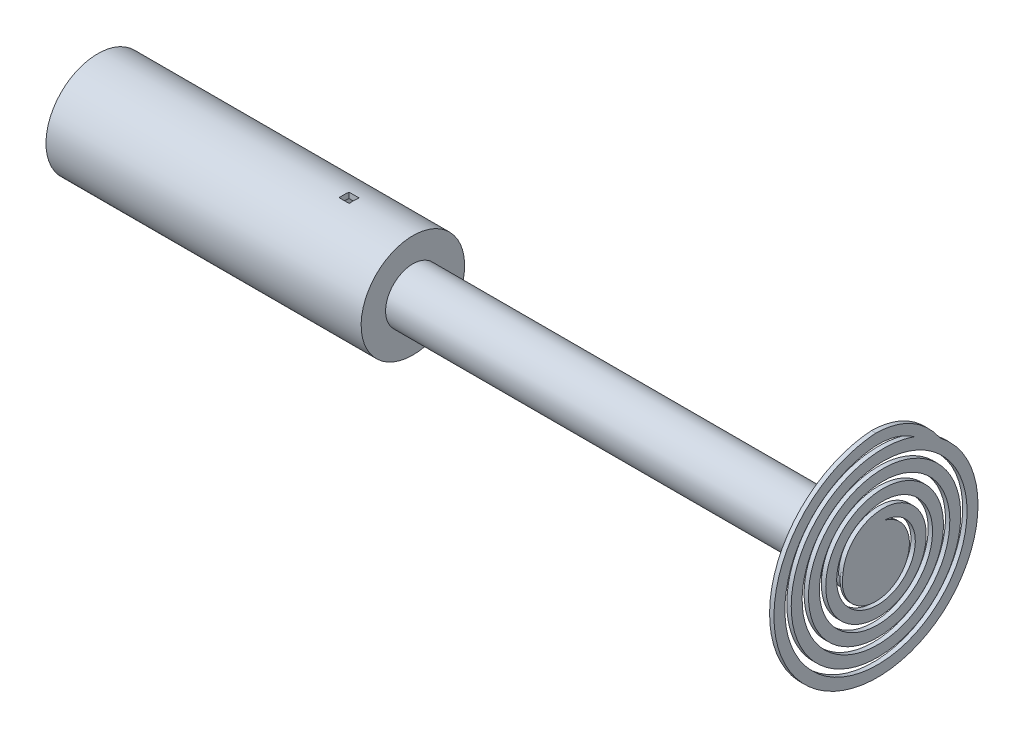
from build123d import *

# Parameters (mm, degrees)
BOSS_EXTRUDE1_DEPTH      = 10
BOSS_EXTRUDE1_DEPTH_BACK = 400
SKETCH1_R                = 24.95
CUT_EXTRUDE2_DEPTH       = 37
CUT_EXTRUDE2_DEPTH_BACK  = 119
SKETCH4_W                = 9.200985146
SKETCH4_H                = 9.100014535
BOSS_EXTRUDE3_DEPTH      = 11
BOSS_EXTRUDE3_DEPTH_BACK = 1
SKETCH5_R                = 24.95
SWEEP1_START             = 19
SWEEP1_DEPTH             = 4
SKETCH10_R               = 30.659130024
BOSS_EXTRUDE4_DEPTH      = 2
BOSS_EXTRUDE5_DEPTH      = 4


# Read off the part's stored shape, not the designer's step: Sweep1
with BuildPart() as part:
    # Sketch1 → Boss-Extrude1 (new, two sides: drawn at the far end of the back side and taken through both)
    with BuildSketch(Plane(origin=(0, 0, 0), x_dir=(0, 0, -1), z_dir=(1, 0, 0)).offset(-BOSS_EXTRUDE1_DEPTH_BACK)):
        Circle(SKETCH1_R)
    extrude(amount=BOSS_EXTRUDE1_DEPTH + BOSS_EXTRUDE1_DEPTH_BACK)

    # Sketch2 → Revolve1 (revolve)
    with BuildSketch(Plane.XY, mode=Mode.PRIVATE) as revolve1_sk:
        Polygon((-440, 42.271499293), (-440, 47.271499293), (-479.272562378, 47.271499293), (-479.272562378, 42.271499293), (-479.272562378, 0), (-473.972562378, 0), (-473.972562378, 42.271499293), (-445.301695371, 42.271499293), (-445.301695371, 0), (-440, 0), align=None)
        Polygon((-479.272562378, 42.271499293), (-479.272562378, 47.271499293), (-687.950461479, 47.271499293), (-687.950461479, 0), (-682.950461479, 0), (-682.950461479, 42.271499293), align=None)
        Polygon((-405, 0), (-400, 0), (-400, 47.271499293), (-440, 47.271499293), (-440, 42.271499293), (-405, 42.271499293), align=None)
    revolve(revolve1_sk.sketch.rotate(Axis((-687.950461479, 0, 0), (1, 0, 0)), 180), axis=Axis((-687.950461479, 0, 0), (1, 0, 0)))

    # Sketch4 → Cut-Extrude2 (cut, two sides: drawn at the far end of the back side and taken through both)
    with BuildSketch(Plane(origin=(0, 45, 0), x_dir=(1, 0, 0), z_dir=(0, 1, 0)).offset(-CUT_EXTRUDE2_DEPTH_BACK)):
        with Locations((-459.296485762, 1.019413137)):
            Rectangle(SKETCH4_W, SKETCH4_H)
    extrude(amount=CUT_EXTRUDE2_DEPTH + CUT_EXTRUDE2_DEPTH_BACK, mode=Mode.SUBTRACT)

    # Sketch5 → Boss-Extrude3 (add, two sides: drawn at the far end of the back side and taken through both)
    with BuildSketch(Plane(origin=(10, 0, 0), x_dir=(0, 0, -1), z_dir=(1, 0, 0)).offset(-BOSS_EXTRUDE3_DEPTH_BACK)):
        Circle(SKETCH5_R)
    extrude(amount=BOSS_EXTRUDE3_DEPTH + BOSS_EXTRUDE3_DEPTH_BACK)

    # Sweep1 outline → Sweep1 (add)
    with BuildSketch(Plane.YZ.offset(SWEEP1_START)):
        with BuildLine():
            Line((2.889682399, 30.019200586), (2.670037713, 20.021613066))
            add(Edge.make_bspline(
                [(2.670037713, 20.021613066), (4.643254667, 20.140878292), (6.662545734, 20.015193829), (11.641897523, 19.071902133), (14.584072415, 17.932365495), (19.941134402, 14.584553651), (22.353624344, 12.376947085), (26.263217032, 7.140524972), (27.763169757, 4.105304989), (29.571455998, -2.419265568), (29.87843846, -5.906377084), (29.179134374, -12.859641345), (28.170649186, -16.332279615), (24.893235583, -22.769976972), (22.624881883, -25.732354411), (17.077270799, -30.692631645), (13.79213913, -32.693730547), (6.604600395, -35.392201832), (2.70455096, -36.087936126), (-4.861302659, -36.005023473), (-8.525144089, -35.344513577), (-15.508988776, -32.792219927), (-18.825870637, -30.903474221), (-24.708805359, -26.053315077), (-27.271658075, -23.09462018), (-31.304195397, -16.400901436), (-32.772453314, -12.667140536), (-34.387607361, -4.828260302), (-34.533990287, -0.722128058), (-33.424667964, 7.398040179), (-32.168791427, 11.410310225), (-28.335450386, 18.869667973), (-25.759252772, 22.313533361), (-19.526161255, 28.205003207), (-15.870330205, 30.650851897), (-7.860894162, 34.212848377), (-3.506346324, 35.328644571), (5.423050407, 36.041933184), (9.996050772, 35.638843575), (18.839839079, 33.295607183), (23.107056934, 31.356046885), (30.827162477, 26.100786509), (34.277988066, 22.785859155), (39.926308388, 15.112472794), (42.123563256, 10.753155144), (44.958643724, 1.455637595), (45.595433636, -3.480733178), (45.173559737, -13.383039696), (44.114707551, -18.34520589), (40.357726775, -27.721951048), (37.659992193, -32.134209212), (30.878350284, -39.873897065), (26.793665529, -43.201151322), (17.659722415, -48.344574493), (12.612157514, -50.159237486), (2.100453994, -52.011716745), (-3.359889129, -52.048509052), (-14.078039648, -50.275479501), (-19.333340234, -48.465592586), (-29.021200533, -43.144732695), (-33.453609471, -39.633045306), (-40.954540061, -31.255355158), (-44.021099372, -26.390786554), (-48.389443308, -15.821829304), (-49.68934792, -10.121071419), (-50.312947281, 1.488468656), (-49.636052653, 7.394654137), (-46.319177968, 18.734896128), (-43.678516375, 24.168798451), (-36.674807197, 33.922129871), (-32.312811451, 38.23918663), (-22.313001374, 45.225647431), (-16.678454898, 47.892339719), (-4.743941497, 51.216414512), (1.553454898, 51.872639646), (14.103549355, 51.036979724), (20.356076496, 49.544408271), (32.094950248, 44.517288252), (37.578593679, 40.983295342), (47.125953252, 32.217438706), (51.18619716, 26.98828504), (57.374819926, 15.384028706), (59.501456937, 9.011339525), (61.519788441, -4.175546062), (61.410751386, -10.98955791), (58.905750588, -24.288269065), (56.509750158, -30.770044166), (49.640122583, -42.650701102), (45.168467406, -48.045467955), (34.603061849, -57.099183316), (28.511428914, -60.755820522), (15.365315983, -65.862263777), (8.311014507, -67.311255653), (-5.97662676, -67.775734731), (-13.206957507, -66.790522475), (-27.02251219, -62.43325724), (-33.603139387, -59.062283636), (-45.344323883, -50.256266529), (-50.502049592, -44.822905127), (-58.764587457, -32.464951583), (-61.868473385, -25.540497091), (-65.614105935, -10.955969929), (-66.25445254, -3.298834887), (-64.93592769, 11.893084324), (-62.977124734, 19.422988328), (-56.617940707, 33.491748686), (-52.21867532, 40.027337129), (-41.424529685, 51.32917642), (-35.029699101, 56.094372277), (-20.927968339, 63.265791887), (-13.223766128, 65.669915238), (2.647502046, 67.785923343), (10.809631668, 67.496792662), (26.671062152, 64.192813362), (34.366776071, 61.178399939), (48.398204443, 52.70580244), (54.732734909, 47.247524822), (65.284659291, 34.454597951), (69.499293844, 27.12223616), (75.279719997, 11.375262039), (76.84339138, 2.96539662), (77.079837509, -13.997548937), (75.752278341, -22.546870015), (70.292936308, -38.808677318), (66.16085854, -46.519869262), (55.502113657, -60.204584392), (48.977160294, -66.174772851), (34.22414025, -75.656279678), (26.000379343, -79.164408869), (8.753612727, -83.264021274), (-0.265632527, -83.854345872), (-18.084497071, -81.98674165), (-26.882750376, -79.528261274), (-43.249279126, -71.778462452), (-50.813768656, -66.488138918), (-63.822600807, -53.617431661), (-69.26277935, -46.040668011), (-77.353915729, -29.414909556), (-80.002873871, -20.369489801), (-82.148957882, -1.813965179), (-81.645229107, 7.694759788), (-77.47841967, 26.10038195), (-73.815498086, 34.993202593), (-63.68267871, 51.139696073), (-57.215491532, 58.388380611), (-42.155505904, 70.382876562), (-33.56590349, 75.12587437), (-15.203541847, 81.514485982), (-5.432101855, 83.158910244), (14.201968223, 83.101223564), (24.060421388, 81.398356016), (42.746162358, 74.773474565), (51.567840182, 69.853072045), (67.150483526, 57.291013038), (73.907894307, 49.651983542), (83.02659267, 34.930789108), (86.095529682, 28.315572783), (90.573736598, 14.497247388), (91.98302564, 7.292991526), (92.510602739, 0)],
                knots=[0, 0, 0, 0, 0.009219666, 0.009219666, 0.023049165, 0.023049165, 0.036878663, 0.036878663, 0.050708162, 0.050708162, 0.064537661, 0.064537661, 0.078367159, 0.078367159, 0.092196658, 0.092196658, 0.106026157, 0.106026157, 0.119855656, 0.119855656, 0.132532696, 0.132532696, 0.145209737, 0.145209737, 0.157886777, 0.157886777, 0.170563818, 0.170563818, 0.183240858, 0.183240858, 0.195917898, 0.195917898, 0.208594939, 0.208594939, 0.221271979, 0.221271979, 0.23394902, 0.23394902, 0.24662606, 0.24662606, 0.259303101, 0.259303101, 0.271980141, 0.271980141, 0.284657182, 0.284657182, 0.297334222, 0.297334222, 0.310011263, 0.310011263, 0.322688303, 0.322688303, 0.335365344, 0.335365344, 0.348042384, 0.348042384, 0.360719425, 0.360719425, 0.373396465, 0.373396465, 0.386073506, 0.386073506, 0.398750546, 0.398750546, 0.411427587, 0.411427587, 0.424104627, 0.424104627, 0.436781668, 0.436781668, 0.449458708, 0.449458708, 0.462135749, 0.462135749, 0.474812789, 0.474812789, 0.48748983, 0.48748983, 0.50016687, 0.50016687, 0.512843911, 0.512843911, 0.525520951, 0.525520951, 0.538197992, 0.538197992, 0.550875032, 0.550875032, 0.563552073, 0.563552073, 0.576229113, 0.576229113, 0.588906154, 0.588906154, 0.601583194, 0.601583194, 0.614260235, 0.614260235, 0.626937275, 0.626937275, 0.639614316, 0.639614316, 0.652291356, 0.652291356, 0.664968397, 0.664968397, 0.677645437, 0.677645437, 0.690322478, 0.690322478, 0.702999518, 0.702999518, 0.715676559, 0.715676559, 0.728353599, 0.728353599, 0.74103064, 0.74103064, 0.75370768, 0.75370768, 0.766384721, 0.766384721, 0.779061761, 0.779061761, 0.791738802, 0.791738802, 0.804415842, 0.804415842, 0.817092883, 0.817092883, 0.829769923, 0.829769923, 0.842446964, 0.842446964, 0.855124004, 0.855124004, 0.867801044, 0.867801044, 0.880478085, 0.880478085, 0.893155125, 0.893155125, 0.905832166, 0.905832166, 0.918509206, 0.918509206, 0.931186247, 0.931186247, 0.943863287, 0.943863287, 0.956540328, 0.956540328, 0.969217368, 0.969217368, 0.981894409, 0.981894409, 0.990947204, 0.990947204, 1, 1, 1, 1], degree=3))
            Line((92.510602739, 0), (102.510602739, 0))
            add(Edge.make_bspline(
                [(2.889682399, 30.019200586), (5.691084805, 30.120256946), (8.523879539, 29.875281477), (15.499121192, 28.381310391), (19.567005722, 26.689596347), (26.901104873, 21.869986211), (30.165037568, 18.742679079), (35.393902459, 11.403306197), (37.351128022, 7.201677346), (39.624174812, -1.741541495), (39.938675573, -6.48102805), (38.794090539, -15.874805061), (37.336372241, -20.516068579), (32.771042872, -29.051276323), (29.663937725, -32.942658708), (22.142619365, -39.403489175), (17.738297601, -41.964156121), (8.186553276, -45.342597908), (3.041357375, -46.158776227), (-6.889774002, -45.86277919), (-11.658622464, -44.9076015), (-20.693265529, -41.417451048), (-24.95901475, -38.882138196), (-32.466414675, -32.463777872), (-35.708227078, -28.580929302), (-40.751811372, -19.867576603), (-42.552658677, -15.039074898), (-44.450511361, -4.956528095), (-44.54623969, 0.292434058), (-42.958731458, 10.619236803), (-41.27466583, 15.694692797), (-36.257829017, 25.075213839), (-32.924760203, 29.379595385), (-24.936539869, 36.690374885), (-20.283279694, 39.695347179), (-10.144181066, 44.014053353), (-4.663179846, 45.325385631), (6.522838496, 46.045110769), (12.225546259, 45.452147581), (23.198744129, 42.365972798), (28.46847578, 39.872365991), (37.951076622, 33.208694107), (42.162026763, 29.040280495), (49.006823713, 19.450686008), (51.637189581, 14.033842985), (54.963999939, 2.534917713), (55.658555026, -3.545053569), (54.96985722, -15.685886814), (53.586063008, -21.745933051), (48.833932165, -33.146475138), (45.466877232, -38.484599714), (37.072660723, -47.805191519), (32.049092058, -51.783202556), (20.872368021, -57.881346463), (14.720996065, -59.999080371), (1.966681952, -62.074112736), (-4.635422478, -62.030679799), (-17.543827222, -59.723179466), (-23.847379289, -57.45990176), (-35.426630305, -50.906473191), (-40.697059115, -46.618946901), (-49.571284533, -36.453633578), (-53.172228748, -30.577174867), (-58.242603599, -17.867372813), (-59.711078708, -11.034837742), (-60.286681373, 2.828127244), (-59.394000874, 9.855539616), (-55.283277346, 23.30856349), (-52.06670292, 29.728304385), (-43.615411519, 41.208953005), (-38.381450074, 46.266643576), (-26.444077588, 54.401847574), (-19.741380638, 57.4781621), (-5.597039738, 61.243464337), (1.841453551, 61.931965458), (16.625689987, 60.779247716), (23.965219461, 58.938201955), (37.703739767, 52.872571184), (44.099268003, 48.648069395), (55.187887508, 38.240159933), (59.879536114, 32.057298455), (66.978033791, 18.391905471), (69.383669312, 10.912499162), (71.577189492, -4.523703304), (71.363870663, -12.474232862), (68.279170137, -27.949942041), (65.407125945, -35.471559583), (57.269373979, -49.212870427), (52.003967191, -55.430898578), (39.624438382, -65.820101875), (32.513243052, -69.989326326), (17.209871841, -75.755178387), (9.023706174, -77.349210938), (-7.514549339, -77.720747042), (-15.863144201, -76.496802021), (-31.770141495, -71.306092546), (-39.326700534, -67.339309094), (-52.765470081, -57.052948937), (-58.645024679, -50.735922354), (-68.019966398, -36.415872571), (-71.511422461, -28.418290062), (-75.655576586, -11.617049661), (-76.3060382, -2.816640261), (-74.628825444, 14.597639567), (-72.300746341, 23.2095552), (-64.865972819, 39.256987173), (-59.761279253, 46.689217962), (-47.294176719, 59.503451557), (-39.936338272, 64.880314272), (-23.757915605, 72.922876497), (-14.94015036, 75.585592045), (3.178043245, 77.835059992), (12.476492689, 77.420971564), (30.50302792, 73.497854516), (39.227316664, 69.990120907), (55.098832696, 60.213988791), (62.239906241, 53.949018947), (74.094033698, 39.319016464), (78.803440023, 30.956196757), (85.20327035, 13.045453154), (86.892388264, 3.4994284), (86.996017586, -15.71128783), (85.410988212, -25.371827795), (79.080206664, -43.713261145), (74.336514265, -52.387244126), (62.168552935, -67.742888026), (54.745731389, -74.420364036), (38.01598911, -84.977656652), (28.710772678, -88.855698713), (9.241464479, -93.315356088), (-0.918310916, -93.896501074), (-20.956542909, -91.631544545), (-30.827640624, -88.785965593), (-49.15367337, -79.927411889), (-57.604051238, -73.914986768), (-72.093500454, -59.349641145), (-78.130354949, -50.798110504), (-87.057240858, -32.081862405), (-89.945822883, -21.921412599), (-92.18787932, -1.113425549), (-91.540241042, 9.52665009), (-86.718560579, 30.086216775), (-82.544074807, 40.000976057), (-71.080275126, 57.96182286), (-63.791920116, 66.005308315), (-46.874086829, 79.271183184), (-37.248600504, 84.49114479), (-16.709040801, 91.464562376), (-5.802164669, 93.215251011), (16.076690698, 92.988202463), (27.043985365, 91.008977741), (47.790573271, 83.480920946), (57.566966967, 77.932511349), (74.795519402, 63.834734311), (82.244326085, 55.28885471), (92.259156349, 38.856042892), (95.613974398, 31.485226261), (100.476534813, 16.104132721), (101.983041831, 8.097256725), (102.510602739, 0)],
                knots=[0, 0, 0, 0, 0.009219666, 0.009219666, 0.023049165, 0.023049165, 0.036878663, 0.036878663, 0.050708162, 0.050708162, 0.064537661, 0.064537661, 0.078367159, 0.078367159, 0.092196658, 0.092196658, 0.106026157, 0.106026157, 0.119855656, 0.119855656, 0.132532696, 0.132532696, 0.145209737, 0.145209737, 0.157886777, 0.157886777, 0.170563818, 0.170563818, 0.183240858, 0.183240858, 0.195917898, 0.195917898, 0.208594939, 0.208594939, 0.221271979, 0.221271979, 0.23394902, 0.23394902, 0.24662606, 0.24662606, 0.259303101, 0.259303101, 0.271980141, 0.271980141, 0.284657182, 0.284657182, 0.297334222, 0.297334222, 0.310011263, 0.310011263, 0.322688303, 0.322688303, 0.335365344, 0.335365344, 0.348042384, 0.348042384, 0.360719425, 0.360719425, 0.373396465, 0.373396465, 0.386073506, 0.386073506, 0.398750546, 0.398750546, 0.411427587, 0.411427587, 0.424104627, 0.424104627, 0.436781668, 0.436781668, 0.449458708, 0.449458708, 0.462135749, 0.462135749, 0.474812789, 0.474812789, 0.48748983, 0.48748983, 0.50016687, 0.50016687, 0.512843911, 0.512843911, 0.525520951, 0.525520951, 0.538197992, 0.538197992, 0.550875032, 0.550875032, 0.563552073, 0.563552073, 0.576229113, 0.576229113, 0.588906154, 0.588906154, 0.601583194, 0.601583194, 0.614260235, 0.614260235, 0.626937275, 0.626937275, 0.639614316, 0.639614316, 0.652291356, 0.652291356, 0.664968397, 0.664968397, 0.677645437, 0.677645437, 0.690322478, 0.690322478, 0.702999518, 0.702999518, 0.715676559, 0.715676559, 0.728353599, 0.728353599, 0.74103064, 0.74103064, 0.75370768, 0.75370768, 0.766384721, 0.766384721, 0.779061761, 0.779061761, 0.791738802, 0.791738802, 0.804415842, 0.804415842, 0.817092883, 0.817092883, 0.829769923, 0.829769923, 0.842446964, 0.842446964, 0.855124004, 0.855124004, 0.867801044, 0.867801044, 0.880478085, 0.880478085, 0.893155125, 0.893155125, 0.905832166, 0.905832166, 0.918509206, 0.918509206, 0.931186247, 0.931186247, 0.943863287, 0.943863287, 0.956540328, 0.956540328, 0.969217368, 0.969217368, 0.981894409, 0.981894409, 0.990947204, 0.990947204, 1, 1, 1, 1], degree=3))
        make_face()
    extrude(amount=SWEEP1_DEPTH)

    # Sketch10 → Boss-Extrude4 (add)
    with BuildSketch(Plane(origin=(21, 0, 0), x_dir=(0, 0, -1), z_dir=(1, 0, 0))):
        Circle(SKETCH10_R)
    extrude(amount=BOSS_EXTRUDE4_DEPTH)

    # Sketch11 → Boss-Extrude5 (add)
    with BuildSketch(Plane(origin=(23, 0, 0), x_dir=(0, 0, -1), z_dir=(1, 0, 0))):
        with BuildLine():
            Line((0, 92.510602739), (0, 102.510602739))
            add(Edge.make_bspline(
                [(0, 102.510602739), (36.395913303, 101.574203444), (58.77219191, 69.257203154)],
                knots=[0, 0, 0, 1, 1, 1], degree=2))
            add(Edge.make_bspline(
                [(35.112067087, 82.046765449), (43.562421882, 79.063063207), (51.580267064, 74.737379524), (58.77219191, 69.257203154)],
                knots=[0.779324482, 0.779324482, 0.779324482, 0.779324482, 0.791032297, 0.791032297, 0.791032297, 0.791032297], degree=3))
            add(Edge.make_bspline(
                [(0, 92.510602739), (13.103185227, 92.930164561), (24.807207593, 89.442218808), (35.112067087, 82.046765449)],
                knots=[0, 0, 0, 0, 0.831764326, 0.831764326, 0.831764326, 0.831764326], degree=3))
        make_face()
    extrude(amount=-BOSS_EXTRUDE5_DEPTH)


solid = part.part
